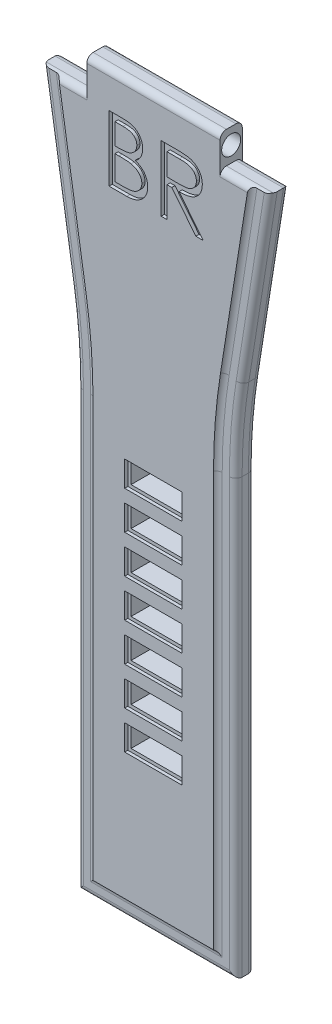
from build123d import *

# Parameters (mm, degrees)
SALIENTE_EXTRUIR1_DEPTH = 3.5
REDONDEO1_R             = 86
CORTAR_EXTRUIR1_DEPTH   = 0.5
REDONDEO2_R             = 1
REDONDEO3_R             = 1
CROQUIS3_R              = 1.5
CORTAR_EXTRUIR3_DEPTH   = 119.532810917
CROQUIS4_W              = 8
CROQUIS4_H              = 3
CORTAR_EXTRUIR4_DEPTH   = 119.532810917
MATRIZL1_COUNT          = 7
MATRIZL1_PITCH          = 6
CROQUIS5_W              = 9
CROQUIS5_H              = 4
CROQUIS5_W_2            = 8
CROQUIS5_H_2            = 3
CORTAR_EXTRUIR5_DEPTH   = 0.5
CORTAR_EXTRUIR6_DEPTH   = 0.5


with BuildPart() as part:
    # Croquis1 → Saliente-Extruir1 (new body)
    with BuildSketch(Plane.XY):
        Polygon((0, 0), (21, 0), (21, -5), (28.5, -5), (22.971798144, -39.903692839), (22.971798144, -115.002292401), (-2.025870662, -115.002292401), (-2.025870662, -39.562292401), (-7.5, -5), (0, -5), align=None)
    extrude(amount=SALIENTE_EXTRUIR1_DEPTH)

    # Redondeo1
    redondeo1_edges = [part.edges().sort_by_distance(p)[0] for p in [
        (22.971798144, -39.903692839, 1.75),
        (-2.025870662, -39.562292401, 1.75),
    ]]
    fillet(redondeo1_edges, radius=REDONDEO1_R)

    # Croquis2 → Cortar-Extruir1 (cut)
    with BuildSketch(Plane.XY.offset(3.5)):
        with BuildLine():
            Line((-4.462604623, -5), (-0.121608349, -32.407971799))
            ThreePointArc((-0.121608349, -32.407971799), (0.699772041, -39.347779668), (0.974129338, -46.330639188))
            Line((0.974129338, -46.330639188), (0.974129338, -112.002292401))
            Line((0.974129338, -112.002292401), (19.971798144, -112.002292401))
            Line((19.971798144, -112.002292401), (19.971798144, -46.672039626))
            ThreePointArc((19.971798144, -46.672039626), (20.246155442, -39.689180106), (21.067535831, -32.749372238))
            Line((21.067535831, -32.749372238), (25.462604623, -5))
            Line((25.462604623, -5), (28.5, -5))
            Line((28.5, -5), (24.030600853, -33.218675633))
            ThreePointArc((24.030600853, -33.218675633), (23.236907443, -39.924557394), (22.971798144, -46.672039626))
            Line((22.971798144, -46.672039626), (22.971798144, -115.002292401))
            Line((22.971798144, -115.002292401), (-2.025870662, -115.002292401))
            Line((-2.025870662, -115.002292401), (-2.025870662, -46.330639188))
            ThreePointArc((-2.025870662, -46.330639188), (-2.290979961, -39.583156955), (-3.084673371, -32.877275194))
            Line((-3.084673371, -32.877275194), (-7.5, -5))
            Line((-7.5, -5), (-4.462604623, -5))
        make_face()
    extrude(amount=-CORTAR_EXTRUIR1_DEPTH, mode=Mode.SUBTRACT)

    # Redondeo2
    # the kernel refuses this fillet: 1 mm, written as the material it adds along each edge
    with BuildSketch(Plane(origin=(21.067535831, -32.749372238, 3), x_dir=(0.9876883405951371, -0.1564344650402353, 0), z_dir=(0.15643446504023528, 0.9876883405951371, 0))) as redondeo2_piece_1_section:
        with BuildLine():
            CenterArc((0.866025404, -1), REDONDEO2_R, 90, 60)
            Line((0, -0.5), (-0.017320508, -0.49))
            ThreePointArc((-0.017320508, -0.49), (-0.02, -0.25), (-0.02, 0))
            Line((-0.02, 0), (0, 0.02))
            Line((0, 0.02), (0.866025404, 0.02))
            Line((0.866025404, 0.02), (0.866025404, 0))
        make_face()
    redondeo2_piece_1 = extrude(amount=30.260335163, mode=Mode.PRIVATE)
    redondeo2_piece_1 = split(redondeo2_piece_1, bisect_by=Plane(origin=(23.481611046, -5, 3.129439208), z_dir=(0, -1, 0)), keep=Keep.TOP, mode=Mode.PRIVATE)
    add(redondeo2_piece_1)
    with BuildSketch(Plane(origin=(108.971798144, -46.672039626, 3), x_dir=(-1, 0, 0), z_dir=(0, -1, 0))) as redondeo2_piece_2:
        with BuildLine():
            CenterArc((88.133974596, -1), REDONDEO2_R, 30, 60)
            Line((89, -0.5), (89.017320508, -0.49))
            ThreePointArc((89.017320508, -0.49), (89.02, -0.25), (89.02, 0))
            Line((89.02, 0), (89, 0.02))
            Line((89, 0.02), (88.133974596, 0.02))
            Line((88.133974596, 0.02), (88.133974596, 0))
        make_face()
    revolve(axis=Axis((108.971798144, -46.672039626, 3), (0, 0, -1)), revolution_arc=9)
    with BuildSketch(Plane(origin=(0.974129338, -46.330639188, 3), x_dir=(-1, 0, 0), z_dir=(0, -1, 0))) as redondeo2_piece_3:
        with BuildLine():
            CenterArc((0.866025404, -1), REDONDEO2_R, 90, 60)
            Line((0, -0.5), (-0.017320508, -0.49))
            ThreePointArc((-0.017320508, -0.49), (-0.02, -0.25), (-0.02, 0))
            Line((-0.02, 0), (0, 0.02))
            Line((0, 0.02), (0.866025404, 0.02))
            Line((0.866025404, 0.02), (0.866025404, 0))
        make_face()
    extrude(amount=65.671653213)
    with BuildSketch(Plane(origin=(-88.025870662, -46.330639188, 3), x_dir=(0.987688340595138, 0.1564344650402287, 0), z_dir=(-0.1564344650402287, 0.987688340595138, 0))) as redondeo2_piece_4:
        with BuildLine():
            CenterArc((88.133974596, -1), REDONDEO2_R, 30, 60)
            Line((89, -0.5), (89.017320508, -0.49))
            ThreePointArc((89.017320508, -0.49), (89.02, -0.25), (89.02, 0))
            Line((89.02, 0), (89, 0.02))
            Line((89, 0.02), (88.133974596, 0.02))
            Line((88.133974596, 0.02), (88.133974596, 0))
        make_face()
    revolve(axis=Axis((-88.025870662, -46.330639188, 3), (0, 0, -1)), revolution_arc=9)
    with BuildSketch(Plane(origin=(19.971798144, -112.002292401, 3), x_dir=(1, 0, 0), z_dir=(0, 1, 0))) as redondeo2_piece_5:
        with BuildLine():
            CenterArc((0.866025404, -1), REDONDEO2_R, 90, 60)
            Line((0, -0.5), (-0.017320508, -0.49))
            ThreePointArc((-0.017320508, -0.49), (-0.02, -0.25), (-0.02, 0))
            Line((-0.02, 0), (0, 0.02))
            Line((0, 0.02), (0.866025404, 0.02))
            Line((0.866025404, 0.02), (0.866025404, 0))
        make_face()
    extrude(amount=65.330252775)
    with BuildSketch(Plane(origin=(0.974129338, -112.002292401, 3), x_dir=(0, -1, 0), z_dir=(1, 0, 0))) as redondeo2_piece_6:
        with BuildLine():
            CenterArc((0.866025404, -1), REDONDEO2_R, 90, 60)
            Line((0, -0.5), (-0.017320508, -0.49))
            ThreePointArc((-0.017320508, -0.49), (-0.02, -0.25), (-0.02, 0))
            Line((-0.02, 0), (0, 0.02))
            Line((0, 0.02), (0.866025404, 0.02))
            Line((0.866025404, 0.02), (0.866025404, 0))
        make_face()
    extrude(amount=18.997668806)
    with BuildSketch(Plane(origin=(-4.801295175, -2.861592015, 3), x_dir=(-0.9876883405951382, -0.1564344650402279, 0), z_dir=(0.1564344650402279, -0.9876883405951382, 0))) as redondeo2_piece_7_section:
        with BuildLine():
            CenterArc((0.866025404, -1), REDONDEO2_R, 90, 60)
            Line((0, -0.5), (-0.017320508, -0.49))
            ThreePointArc((-0.017320508, -0.49), (-0.02, -0.25), (-0.02, 0))
            Line((-0.02, 0), (0, 0.02))
            Line((0, 0.02), (0.866025404, 0.02))
            Line((0.866025404, 0.02), (0.866025404, 0))
        make_face()
    redondeo2_piece_7 = extrude(amount=29.914679125, mode=Mode.PRIVATE)
    redondeo2_piece_7 = split(redondeo2_piece_7, bisect_by=Plane(origin=(-2.508649964, -5, 3.129438243), z_dir=(0, -1, 0)), keep=Keep.TOP, mode=Mode.PRIVATE)
    add(redondeo2_piece_7)
    with BuildSketch(Plane(origin=(0.974129338, -46.330639188, 3), x_dir=(-1, 0, 0), z_dir=(0, -1, 0))) as redondeo2_piece_8a_section:
        with BuildLine():
            CenterArc((0.866025404, -1), REDONDEO2_R, 90, 60)
            Line((0, -0.5), (-0.017320508, -0.49))
            ThreePointArc((-0.017320508, -0.49), (-0.02, -0.25), (-0.02, 0))
            Line((-0.02, 0), (0, 0.02))
            Line((0, 0.02), (0.866025404, 0.02))
            Line((0.866025404, 0.02), (0.866025404, 0))
        make_face()
    redondeo2_piece_8a = extrude(amount=67.836716723, mode=Mode.PRIVATE)
    redondeo2_piece_8a = split(redondeo2_piece_8a, bisect_by=Plane(origin=(0.757818892, -112.002292401, 3.129516711), z_dir=(0, -1, 0)), keep=Keep.TOP, mode=Mode.PRIVATE)
    with BuildSketch(Plane(origin=(-1.190934171, -112.002292401, 3), x_dir=(0, -1, 0), z_dir=(1, 0, 0))) as redondeo2_piece_8b_section:
        with BuildLine():
            CenterArc((0.866025404, -1), REDONDEO2_R, 90, 60)
            Line((0, -0.5), (-0.017320508, -0.49))
            ThreePointArc((-0.017320508, -0.49), (-0.02, -0.25), (-0.02, 0))
            Line((-0.02, 0), (0, 0.02))
            Line((0, 0.02), (0.866025404, 0.02))
            Line((0.866025404, 0.02), (0.866025404, 0))
        make_face()
    redondeo2_piece_8b = extrude(amount=21.162732316, mode=Mode.PRIVATE)
    redondeo2_piece_8b = split(redondeo2_piece_8b, bisect_by=Plane(origin=(0.974129338, -112.218602847, 3.129516711), z_dir=(-1, 0, 0)), keep=Keep.TOP, mode=Mode.PRIVATE)
    redondeo2_piece_8 = redondeo2_piece_8a & redondeo2_piece_8b
    add(redondeo2_piece_8)
    with BuildSketch(Plane(origin=(0.974129338, -112.002292401, 3), x_dir=(0, -1, 0), z_dir=(1, 0, 0))) as redondeo2_piece_9a_section:
        with BuildLine():
            CenterArc((0.866025404, -1), REDONDEO2_R, 90, 60)
            Line((0, -0.5), (-0.017320508, -0.49))
            ThreePointArc((-0.017320508, -0.49), (-0.02, -0.25), (-0.02, 0))
            Line((-0.02, 0), (0, 0.02))
            Line((0, 0.02), (0.866025404, 0.02))
            Line((0.866025404, 0.02), (0.866025404, 0))
        make_face()
    redondeo2_piece_9a = extrude(amount=21.162732316, mode=Mode.PRIVATE)
    redondeo2_piece_9a = split(redondeo2_piece_9a, bisect_by=Plane(origin=(19.971798144, -112.218602847, 3.129516711), z_dir=(1, 0, 0)), keep=Keep.TOP, mode=Mode.PRIVATE)
    with BuildSketch(Plane(origin=(19.971798144, -114.16735591, 3), x_dir=(1, 0, 0), z_dir=(0, 1, 0))) as redondeo2_piece_9b_section:
        with BuildLine():
            CenterArc((0.866025404, -1), REDONDEO2_R, 90, 60)
            Line((0, -0.5), (-0.017320508, -0.49))
            ThreePointArc((-0.017320508, -0.49), (-0.02, -0.25), (-0.02, 0))
            Line((-0.02, 0), (0, 0.02))
            Line((0, 0.02), (0.866025404, 0.02))
            Line((0.866025404, 0.02), (0.866025404, 0))
        make_face()
    redondeo2_piece_9b = extrude(amount=67.495316284, mode=Mode.PRIVATE)
    redondeo2_piece_9b = split(redondeo2_piece_9b, bisect_by=Plane(origin=(20.18810859, -112.002292401, 3.129516711), z_dir=(0, -1, 0)), keep=Keep.TOP, mode=Mode.PRIVATE)
    redondeo2_piece_9 = redondeo2_piece_9a & redondeo2_piece_9b
    add(redondeo2_piece_9)

    # Redondeo3
    # the kernel refuses this fillet: 1 mm, written as the material it takes off along each edge
    with BuildSketch(Plane(origin=(29.43860679, 0.926130044, 0), x_dir=(-0.9876883405951371, 0.1564344650402347, 0), z_dir=(-0.1564344650402347, -0.9876883405951372, 0))) as redondeo3_piece_1:
        with BuildLine():
            CenterArc((REDONDEO3_R, -REDONDEO3_R), REDONDEO3_R, 90, 90)
            Line((0, -REDONDEO3_R), (-REDONDEO3_R * 0.02, -REDONDEO3_R))
            Line((-REDONDEO3_R * 0.02, -REDONDEO3_R), (-REDONDEO3_R * 0.02, REDONDEO3_R * 0.02))
            Line((-REDONDEO3_R * 0.02, REDONDEO3_R * 0.02), (REDONDEO3_R, REDONDEO3_R * 0.02))
            Line((REDONDEO3_R, REDONDEO3_R * 0.02), (REDONDEO3_R, 0))
        make_face()
    extrude(amount=34.570424974, mode=Mode.SUBTRACT)
    with BuildSketch(Plane(origin=(108.971798144, -46.672039626, 0), x_dir=(-0.987688340595137, 0.15643446504023548, 0), z_dir=(0.15643446504023548, 0.987688340595137, 0))) as redondeo3_piece_2:
        with BuildLine():
            CenterArc((86 + REDONDEO3_R, REDONDEO3_R), REDONDEO3_R, 180, 90)
            Line((86, REDONDEO3_R), (86 - REDONDEO3_R * 0.02, REDONDEO3_R))
            Line((86 - REDONDEO3_R * 0.02, REDONDEO3_R), (86 - REDONDEO3_R * 0.02, -REDONDEO3_R * 0.02))
            Line((86 - REDONDEO3_R * 0.02, -REDONDEO3_R * 0.02), (86 + REDONDEO3_R, -REDONDEO3_R * 0.02))
            Line((86 + REDONDEO3_R, -REDONDEO3_R * 0.02), (86 + REDONDEO3_R, 0))
        make_face()
    revolve(axis=Axis((108.971798144, -46.672039626, 0), (0, 0, 1)), revolution_arc=9, mode=Mode.SUBTRACT)
    with BuildSketch(Plane(origin=(29.43860679, 0.926130044, 3), x_dir=(-0.9876883405951371, 0.15643446504023462, 0), z_dir=(-0.15643446504023462, -0.9876883405951372, 0))) as redondeo3_piece_3:
        with BuildLine():
            CenterArc((REDONDEO3_R, REDONDEO3_R), REDONDEO3_R, 180, 90)
            Line((0, REDONDEO3_R), (-REDONDEO3_R * 0.02, REDONDEO3_R))
            Line((-REDONDEO3_R * 0.02, REDONDEO3_R), (-REDONDEO3_R * 0.02, -REDONDEO3_R * 0.02))
            Line((-REDONDEO3_R * 0.02, -REDONDEO3_R * 0.02), (REDONDEO3_R, -REDONDEO3_R * 0.02))
            Line((REDONDEO3_R, -REDONDEO3_R * 0.02), (REDONDEO3_R, 0))
        make_face()
    extrude(amount=34.570424974, mode=Mode.SUBTRACT)
    with BuildSketch(Plane(origin=(108.971798144, -46.672039626, 3), x_dir=(-0.9876883405951384, 0.15643446504022676, 0), z_dir=(0.15643446504022676, 0.9876883405951384, 0))) as redondeo3_piece_4:
        with BuildLine():
            CenterArc((86 + REDONDEO3_R, -REDONDEO3_R), REDONDEO3_R, 90, 90)
            Line((86, -REDONDEO3_R), (86 - REDONDEO3_R * 0.02, -REDONDEO3_R))
            Line((86 - REDONDEO3_R * 0.02, -REDONDEO3_R), (86 - REDONDEO3_R * 0.02, REDONDEO3_R * 0.02))
            Line((86 - REDONDEO3_R * 0.02, REDONDEO3_R * 0.02), (86 + REDONDEO3_R, REDONDEO3_R * 0.02))
            Line((86 + REDONDEO3_R, REDONDEO3_R * 0.02), (86 + REDONDEO3_R, 0))
        make_face()
    revolve(axis=Axis((108.971798144, -46.672039626, 3), (0, 0, 1)), revolution_arc=9, mode=Mode.SUBTRACT)
    with BuildSketch(Plane(origin=(-3.084673371, -32.877275194, 0), x_dir=(0.9876883405951382, 0.15643446504022784, 0), z_dir=(-0.15643446504022784, 0.9876883405951382, 0))) as redondeo3_piece_5:
        with BuildLine():
            CenterArc((REDONDEO3_R, -REDONDEO3_R), REDONDEO3_R, 90, 90)
            Line((0, -REDONDEO3_R), (-REDONDEO3_R * 0.02, -REDONDEO3_R))
            Line((-REDONDEO3_R * 0.02, -REDONDEO3_R), (-REDONDEO3_R * 0.02, REDONDEO3_R * 0.02))
            Line((-REDONDEO3_R * 0.02, REDONDEO3_R * 0.02), (REDONDEO3_R, REDONDEO3_R * 0.02))
            Line((REDONDEO3_R, REDONDEO3_R * 0.02), (REDONDEO3_R, 0))
        make_face()
    extrude(amount=34.224768936, mode=Mode.SUBTRACT)
    with BuildSketch(Plane(origin=(-88.025870662, -46.330639188, 0), x_dir=(1, 0, 0), z_dir=(0, -1, 0))) as redondeo3_piece_6:
        with BuildLine():
            CenterArc((86 + REDONDEO3_R, REDONDEO3_R), REDONDEO3_R, 180, 90)
            Line((86, REDONDEO3_R), (86 - REDONDEO3_R * 0.02, REDONDEO3_R))
            Line((86 - REDONDEO3_R * 0.02, REDONDEO3_R), (86 - REDONDEO3_R * 0.02, -REDONDEO3_R * 0.02))
            Line((86 - REDONDEO3_R * 0.02, -REDONDEO3_R * 0.02), (86 + REDONDEO3_R, -REDONDEO3_R * 0.02))
            Line((86 + REDONDEO3_R, -REDONDEO3_R * 0.02), (86 + REDONDEO3_R, 0))
        make_face()
    revolve(axis=Axis((-88.025870662, -46.330639188, 0), (0, 0, 1)), revolution_arc=9, mode=Mode.SUBTRACT)
    with BuildSketch(Plane(origin=(-3.084673371, -32.877275194, 3), x_dir=(0.9876883405951382, 0.15643446504022784, 0), z_dir=(-0.15643446504022787, 0.9876883405951382, 0))) as redondeo3_piece_7:
        with BuildLine():
            CenterArc((REDONDEO3_R, REDONDEO3_R), REDONDEO3_R, 180, 90)
            Line((0, REDONDEO3_R), (-REDONDEO3_R * 0.02, REDONDEO3_R))
            Line((-REDONDEO3_R * 0.02, REDONDEO3_R), (-REDONDEO3_R * 0.02, -REDONDEO3_R * 0.02))
            Line((-REDONDEO3_R * 0.02, -REDONDEO3_R * 0.02), (REDONDEO3_R, -REDONDEO3_R * 0.02))
            Line((REDONDEO3_R, -REDONDEO3_R * 0.02), (REDONDEO3_R, 0))
        make_face()
    extrude(amount=34.224768936, mode=Mode.SUBTRACT)
    with BuildSketch(Plane(origin=(-88.025870662, -46.330639188, 3), x_dir=(1, 0, 0), z_dir=(0, -1, 0))) as redondeo3_piece_8:
        with BuildLine():
            CenterArc((86 + REDONDEO3_R, -REDONDEO3_R), REDONDEO3_R, 90, 90)
            Line((86, -REDONDEO3_R), (86 - REDONDEO3_R * 0.02, -REDONDEO3_R))
            Line((86 - REDONDEO3_R * 0.02, -REDONDEO3_R), (86 - REDONDEO3_R * 0.02, REDONDEO3_R * 0.02))
            Line((86 - REDONDEO3_R * 0.02, REDONDEO3_R * 0.02), (86 + REDONDEO3_R, REDONDEO3_R * 0.02))
            Line((86 + REDONDEO3_R, REDONDEO3_R * 0.02), (86 + REDONDEO3_R, 0))
        make_face()
    revolve(axis=Axis((-88.025870662, -46.330639188, 3), (0, 0, 1)), revolution_arc=9, mode=Mode.SUBTRACT)
    with BuildSketch(Plane(origin=(21, -5, 0), x_dir=(0, -1, 0), z_dir=(1, 0, 0))) as redondeo3_piece_9:
        with BuildLine():
            CenterArc((REDONDEO3_R, -REDONDEO3_R), REDONDEO3_R, 90, 90)
            Line((0, -REDONDEO3_R), (-REDONDEO3_R * 0.02, -REDONDEO3_R))
            Line((-REDONDEO3_R * 0.02, -REDONDEO3_R), (-REDONDEO3_R * 0.02, REDONDEO3_R * 0.02))
            Line((-REDONDEO3_R * 0.02, REDONDEO3_R * 0.02), (REDONDEO3_R, REDONDEO3_R * 0.02))
            Line((REDONDEO3_R, REDONDEO3_R * 0.02), (REDONDEO3_R, 0))
        make_face()
    extrude(amount=13.5, mode=Mode.SUBTRACT)
    with BuildSketch(Plane(origin=(21, -5, 3.5), x_dir=(0, 0, -1), z_dir=(1, 0, 0)), Plane(origin=(-10.462604623, -5, 3.5), x_dir=(0, 0, -1), z_dir=(1, 0, 0))) as redondeo3_piece_10:
        with BuildLine():
            CenterArc((REDONDEO3_R, -REDONDEO3_R), REDONDEO3_R, 90, 90)
            Line((0, -REDONDEO3_R), (-REDONDEO3_R * 0.02, -REDONDEO3_R))
            Line((-REDONDEO3_R * 0.02, -REDONDEO3_R), (-REDONDEO3_R * 0.02, REDONDEO3_R * 0.02))
            Line((-REDONDEO3_R * 0.02, REDONDEO3_R * 0.02), (REDONDEO3_R, REDONDEO3_R * 0.02))
            Line((REDONDEO3_R, REDONDEO3_R * 0.02), (REDONDEO3_R, 0))
        make_face()
    extrude(amount=10.462604623, mode=Mode.SUBTRACT)
    with BuildSketch(Plane(origin=(-6, 0, 0), x_dir=(0, 0, 1), z_dir=(1, 0, 0))) as redondeo3_piece_11:
        with BuildLine():
            CenterArc((REDONDEO3_R, REDONDEO3_R), REDONDEO3_R, 180, 90)
            Line((0, REDONDEO3_R), (-REDONDEO3_R * 0.02, REDONDEO3_R))
            Line((-REDONDEO3_R * 0.02, REDONDEO3_R), (-REDONDEO3_R * 0.02, -REDONDEO3_R * 0.02))
            Line((-REDONDEO3_R * 0.02, -REDONDEO3_R * 0.02), (REDONDEO3_R, -REDONDEO3_R * 0.02))
            Line((REDONDEO3_R, -REDONDEO3_R * 0.02), (REDONDEO3_R, 0))
        make_face()
    extrude(amount=33, mode=Mode.SUBTRACT)
    with BuildSketch(Plane(origin=(-6, 0, 3.5), x_dir=(0, 0, -1), z_dir=(1, 0, 0))) as redondeo3_piece_12:
        with BuildLine():
            CenterArc((REDONDEO3_R, -REDONDEO3_R), REDONDEO3_R, 90, 90)
            Line((0, -REDONDEO3_R), (-REDONDEO3_R * 0.02, -REDONDEO3_R))
            Line((-REDONDEO3_R * 0.02, -REDONDEO3_R), (-REDONDEO3_R * 0.02, REDONDEO3_R * 0.02))
            Line((-REDONDEO3_R * 0.02, REDONDEO3_R * 0.02), (REDONDEO3_R, REDONDEO3_R * 0.02))
            Line((REDONDEO3_R, REDONDEO3_R * 0.02), (REDONDEO3_R, 0))
        make_face()
    extrude(amount=33, mode=Mode.SUBTRACT)
    with BuildSketch(Plane(origin=(-13.5, -5, 0), x_dir=(0, 0, 1), z_dir=(1, 0, 0))) as redondeo3_piece_13:
        with BuildLine():
            CenterArc((REDONDEO3_R, REDONDEO3_R), REDONDEO3_R, 180, 90)
            Line((0, REDONDEO3_R), (-REDONDEO3_R * 0.02, REDONDEO3_R))
            Line((-REDONDEO3_R * 0.02, REDONDEO3_R), (-REDONDEO3_R * 0.02, -REDONDEO3_R * 0.02))
            Line((-REDONDEO3_R * 0.02, -REDONDEO3_R * 0.02), (REDONDEO3_R, -REDONDEO3_R * 0.02))
            Line((REDONDEO3_R, -REDONDEO3_R * 0.02), (REDONDEO3_R, 0))
        make_face()
    extrude(amount=13.5, mode=Mode.SUBTRACT)
    with BuildSketch(Plane(origin=(28.971798144, -115.002292401, 0), x_dir=(0, 1, 0), z_dir=(-1, 0, 0))) as redondeo3_piece_14:
        with BuildLine():
            CenterArc((REDONDEO3_R, -REDONDEO3_R), REDONDEO3_R, 90, 90)
            Line((0, -REDONDEO3_R), (-REDONDEO3_R * 0.02, -REDONDEO3_R))
            Line((-REDONDEO3_R * 0.02, -REDONDEO3_R), (-REDONDEO3_R * 0.02, REDONDEO3_R * 0.02))
            Line((-REDONDEO3_R * 0.02, REDONDEO3_R * 0.02), (REDONDEO3_R, REDONDEO3_R * 0.02))
            Line((REDONDEO3_R, REDONDEO3_R * 0.02), (REDONDEO3_R, 0))
        make_face()
    extrude(amount=36.997668806, mode=Mode.SUBTRACT)
    with BuildSketch(Plane(origin=(28.971798144, -115.002292401, 3), x_dir=(0, 1, 0), z_dir=(-1, 0, 0))) as redondeo3_piece_15:
        with BuildLine():
            CenterArc((REDONDEO3_R, REDONDEO3_R), REDONDEO3_R, 180, 90)
            Line((0, REDONDEO3_R), (-REDONDEO3_R * 0.02, REDONDEO3_R))
            Line((-REDONDEO3_R * 0.02, REDONDEO3_R), (-REDONDEO3_R * 0.02, -REDONDEO3_R * 0.02))
            Line((-REDONDEO3_R * 0.02, -REDONDEO3_R * 0.02), (REDONDEO3_R, -REDONDEO3_R * 0.02))
            Line((REDONDEO3_R, -REDONDEO3_R * 0.02), (REDONDEO3_R, 0))
        make_face()
    extrude(amount=36.997668806, mode=Mode.SUBTRACT)
    with BuildSketch(Plane(origin=(22.971798144, -46.672039626, 0), x_dir=(-1, 0, 0), z_dir=(0, -1, 0))) as redondeo3_piece_16:
        with BuildLine():
            CenterArc((REDONDEO3_R, -REDONDEO3_R), REDONDEO3_R, 90, 90)
            Line((0, -REDONDEO3_R), (-REDONDEO3_R * 0.02, -REDONDEO3_R))
            Line((-REDONDEO3_R * 0.02, -REDONDEO3_R), (-REDONDEO3_R * 0.02, REDONDEO3_R * 0.02))
            Line((-REDONDEO3_R * 0.02, REDONDEO3_R * 0.02), (REDONDEO3_R, REDONDEO3_R * 0.02))
            Line((REDONDEO3_R, REDONDEO3_R * 0.02), (REDONDEO3_R, 0))
        make_face()
    extrude(amount=74.330252775, mode=Mode.SUBTRACT)
    with BuildSketch(Plane(origin=(22.971798144, -46.672039626, 3), x_dir=(-1, 0, 0), z_dir=(0, -1, 0))) as redondeo3_piece_17:
        with BuildLine():
            CenterArc((REDONDEO3_R, REDONDEO3_R), REDONDEO3_R, 180, 90)
            Line((0, REDONDEO3_R), (-REDONDEO3_R * 0.02, REDONDEO3_R))
            Line((-REDONDEO3_R * 0.02, REDONDEO3_R), (-REDONDEO3_R * 0.02, -REDONDEO3_R * 0.02))
            Line((-REDONDEO3_R * 0.02, -REDONDEO3_R * 0.02), (REDONDEO3_R, -REDONDEO3_R * 0.02))
            Line((REDONDEO3_R, -REDONDEO3_R * 0.02), (REDONDEO3_R, 0))
        make_face()
    extrude(amount=74.330252775, mode=Mode.SUBTRACT)
    with BuildSketch(Plane(origin=(-2.025870662, -121.002292401, 0), x_dir=(1, 0, 0), z_dir=(0, 1, 0))) as redondeo3_piece_18:
        with BuildLine():
            CenterArc((REDONDEO3_R, -REDONDEO3_R), REDONDEO3_R, 90, 90)
            Line((0, -REDONDEO3_R), (-REDONDEO3_R * 0.02, -REDONDEO3_R))
            Line((-REDONDEO3_R * 0.02, -REDONDEO3_R), (-REDONDEO3_R * 0.02, REDONDEO3_R * 0.02))
            Line((-REDONDEO3_R * 0.02, REDONDEO3_R * 0.02), (REDONDEO3_R, REDONDEO3_R * 0.02))
            Line((REDONDEO3_R, REDONDEO3_R * 0.02), (REDONDEO3_R, 0))
        make_face()
    extrude(amount=74.671653213, mode=Mode.SUBTRACT)
    with BuildSketch(Plane(origin=(-2.025870662, -121.002292401, 3), x_dir=(1, 0, 0), z_dir=(0, 1, 0))) as redondeo3_piece_19:
        with BuildLine():
            CenterArc((REDONDEO3_R, REDONDEO3_R), REDONDEO3_R, 180, 90)
            Line((0, REDONDEO3_R), (-REDONDEO3_R * 0.02, REDONDEO3_R))
            Line((-REDONDEO3_R * 0.02, REDONDEO3_R), (-REDONDEO3_R * 0.02, -REDONDEO3_R * 0.02))
            Line((-REDONDEO3_R * 0.02, -REDONDEO3_R * 0.02), (REDONDEO3_R, -REDONDEO3_R * 0.02))
            Line((REDONDEO3_R, -REDONDEO3_R * 0.02), (REDONDEO3_R, 0))
        make_face()
    extrude(amount=74.671653213, mode=Mode.SUBTRACT)

    # Croquis3 → Cortar-Extruir3 (cut, through all)
    with BuildSketch(Plane(origin=(21, 0, 0), x_dir=(0, 0, -1), z_dir=(1, 0, 0))):
        with Locations((-1.75, -2.5)):
            Circle(CROQUIS3_R)
    extrude(amount=-CORTAR_EXTRUIR3_DEPTH, mode=Mode.SUBTRACT)

    # Croquis4 → Cortar-Extruir4 (cut, through all)
    with BuildSketch(Plane.XY.offset(3.5)):
        with Locations((10.472963741, -90.002292401)):
            Rectangle(CROQUIS4_W, CROQUIS4_H)
    cortar_extruir4 = extrude(amount=-CORTAR_EXTRUIR4_DEPTH, mode=Mode.SUBTRACT)

    # MatrizL1: Cortar-Extruir4 ×7
    with Locations(*[(0, i * MATRIZL1_PITCH, 0) for i in range(1, MATRIZL1_COUNT)]):
        add(cortar_extruir4, mode=Mode.SUBTRACT)

    # Croquis5 → Cortar-Extruir5 (cut)
    # profile 1 of 7: a face of its own
    with BuildSketch(Plane.XY.offset(3.5)):
        with Locations((10.472963741, -54.002292401)):
            Rectangle(CROQUIS5_W, CROQUIS5_H)
        with Locations((10.472963741, -54.002292401)):
            Rectangle(CROQUIS5_W_2, CROQUIS5_H_2, mode=Mode.SUBTRACT)
    # profile 2 of 7: a face of its own
    with BuildSketch(Plane.XY.offset(3.5)):
        with Locations((10.472963741, -60.002292401)):
            Rectangle(CROQUIS5_W, CROQUIS5_H)
        with Locations((10.472963741, -60.002292401)):
            Rectangle(CROQUIS5_W_2, CROQUIS5_H_2, mode=Mode.SUBTRACT)
    # profile 3 of 7: a face of its own
    with BuildSketch(Plane.XY.offset(3.5)):
        with Locations((10.472963741, -66.002292401)):
            Rectangle(CROQUIS5_W, CROQUIS5_H)
        with Locations((10.472963741, -66.002292401)):
            Rectangle(CROQUIS5_W_2, CROQUIS5_H_2, mode=Mode.SUBTRACT)
    # profile 4 of 7: a face of its own
    with BuildSketch(Plane.XY.offset(3.5)):
        with Locations((10.472963741, -72.002292401)):
            Rectangle(CROQUIS5_W, CROQUIS5_H)
        with Locations((10.472963741, -72.002292401)):
            Rectangle(CROQUIS5_W_2, CROQUIS5_H_2, mode=Mode.SUBTRACT)
    # profile 5 of 7: a face of its own
    with BuildSketch(Plane.XY.offset(3.5)):
        with Locations((10.472963741, -78.002292401)):
            Rectangle(CROQUIS5_W, CROQUIS5_H)
        with Locations((10.472963741, -78.002292401)):
            Rectangle(CROQUIS5_W_2, CROQUIS5_H_2, mode=Mode.SUBTRACT)
    # profile 6 of 7: a face of its own
    with BuildSketch(Plane.XY.offset(3.5)):
        with Locations((10.472963741, -84.002292401)):
            Rectangle(CROQUIS5_W, CROQUIS5_H)
        with Locations((10.472963741, -84.002292401)):
            Rectangle(CROQUIS5_W_2, CROQUIS5_H_2, mode=Mode.SUBTRACT)
    # profile 7 of 7: a face of its own
    with BuildSketch(Plane.XY.offset(3.5)):
        with Locations((10.472963741, -90.002292401)):
            Rectangle(CROQUIS5_W, CROQUIS5_H)
        with Locations((10.472963741, -90.002292401)):
            Rectangle(CROQUIS5_W_2, CROQUIS5_H_2, mode=Mode.SUBTRACT)
    extrude(amount=-CORTAR_EXTRUIR5_DEPTH, mode=Mode.SUBTRACT)

    # Croquis6 → Cortar-Extruir6 (cut)
    # profile 1 of 2: a face of its own
    with BuildSketch(Plane.XY.offset(3.5)):
        with BuildLine():
            Line((3.515965496, -5.68125), (5.529279298, -5.68125))
            add(Edge.make_bspline(
                [(5.529279298, -5.68125), (5.627833615, -5.68176815), (5.81885641, -5.682772453), (6.096635514, -5.698348256), (6.356811918, -5.719586218), (6.599461076, -5.753284581), (6.824470861, -5.793945695), (7.032519377, -5.843186228), (7.222945046, -5.902228976), (7.450289917, -5.996118638), (7.709498865, -6.135637479), (7.990164126, -6.341801873), (8.230161268, -6.593969903), (8.437085571, -6.878421446), (8.601599229, -7.191332445), (8.720616568, -7.525244803), (8.795966661, -7.875851581), (8.803715849, -8.116553165), (8.807632163, -8.23819987)],
                knots=[0, 0, 0, 0, 1.001505555, 1.941167018, 2.826882275, 3.653841531, 4.429895133, 5.150066043, 5.825578002, 6.45369114, 7.647487171, 8.808567382, 9.977351308, 11.170798116, 12.373658725, 13.556498008, 14.765093433, 16, 16, 16, 16], degree=3))
            add(Edge.make_bspline(
                [(8.807632163, -8.23819987), (8.804409121, -8.352155887), (8.798075539, -8.576090206), (8.737511082, -8.903619446), (8.64269454, -9.2153967), (8.510893886, -9.510284126), (8.339596751, -9.781618939), (8.136587672, -10.031589968), (7.891659456, -10.249613531), (7.708153047, -10.371501267), (7.614940106, -10.433414714)],
                knots=[0, 0, 0, 0, 1.044552857, 2.05264487, 3.044412934, 4.028983338, 5.005914585, 5.980388656, 6.974128949, 8, 8, 8, 8], degree=3))
            add(Edge.make_bspline(
                [(7.614940106, -10.433414714), (7.732162366, -10.478419201), (7.956437589, -10.564523935), (8.265074386, -10.716756348), (8.530988117, -10.882334284), (8.756223274, -11.063153721), (8.948852682, -11.258056661), (9.117056979, -11.469900936), (9.260580102, -11.701450024), (9.383558739, -11.950289732), (9.479519447, -12.21387916), (9.551384836, -12.489745858), (9.592563869, -12.776900618), (9.598423862, -12.972324121), (9.601382163, -13.070979818)],
                knots=[0, 0, 0, 0, 1.27268992, 2.434971085, 3.483601985, 4.442670788, 5.356604649, 6.2567628, 7.179492994, 8.113709626, 9.066344395, 10.018646069, 10.999752585, 12, 12, 12, 12], degree=3))
            add(Edge.make_bspline(
                [(9.601382163, -13.070979818), (9.598502212, -13.171711078), (9.592835827, -13.369902655), (9.551030231, -13.661053954), (9.480246239, -13.93929152), (9.382745413, -14.206415014), (9.25549366, -14.46190766), (9.100629965, -14.706058908), (8.915978695, -14.936415658), (8.709418344, -15.155537625), (8.475736554, -15.352560262), (8.223617784, -15.528025319), (7.949886937, -15.672328799), (7.659039719, -15.793547641), (7.347813494, -15.886142792), (7.017605807, -15.950922648), (6.668701446, -15.99457107), (6.429277697, -15.99815965), (6.30649284, -16)],
                knots=[0, 0, 0, 0, 0.978564426, 1.925352924, 2.850884081, 3.763762016, 4.682927383, 5.618979971, 6.567305752, 7.547517671, 8.540179244, 9.531824382, 10.526200242, 11.540722885, 12.589160233, 13.674978461, 14.80764778, 16, 16, 16, 16], degree=3))
            Line((6.30649284, -16), (3.515965496, -16))
            Line((3.515965496, -16), (3.515965496, -5.68125))
        make_face()
        with BuildLine():
            Line((4.442007163, -6.739583333), (4.442007163, -10.046875))
            Line((4.442007163, -10.046875), (5.064191408, -10.046875))
            add(Edge.make_bspline(
                [(5.064191408, -10.046875), (5.155140267, -10.045695941), (5.330871997, -10.04341776), (5.585361549, -10.036891837), (5.821587273, -10.018618677), (6.039141409, -10.000350768), (6.237681365, -9.970648725), (6.416767285, -9.935293377), (6.579209755, -9.897901455), (6.766537951, -9.834309986), (6.979024447, -9.740327768), (7.205544903, -9.594474194), (7.405240634, -9.420752574), (7.5738702, -9.22030065), (7.711880446, -8.999579091), (7.807737845, -8.762109627), (7.872737963, -8.513810631), (7.878609425, -8.343350032), (7.881590496, -8.256803385)],
                knots=[0, 0, 0, 0, 1.156816544, 2.235205308, 3.236616184, 4.169592532, 5.011045266, 5.787822928, 6.49130361, 7.128639758, 8.301311294, 9.436451833, 10.541879658, 11.654887649, 12.756523258, 13.837046038, 14.901820046, 16, 16, 16, 16], degree=3))
            add(Edge.make_bspline(
                [(7.881590496, -8.256803385), (7.880039204, -8.199532048), (7.876996176, -8.087188067), (7.852074028, -7.923416667), (7.80971534, -7.76939089), (7.755308129, -7.622999932), (7.679277549, -7.488821245), (7.589759553, -7.362215502), (7.481602276, -7.247494239), (7.358492771, -7.140269164), (7.216953063, -7.045205387), (7.057067594, -6.961945565), (6.87667321, -6.894900883), (6.678810132, -6.836183797), (6.460432694, -6.79494331), (6.22406093, -6.760586626), (5.96775875, -6.743095631), (5.790438099, -6.740780213), (5.698777996, -6.739583333)],
                knots=[0, 0, 0, 0, 0.91205012, 1.789085906, 2.630437955, 3.453916878, 4.269457761, 5.079663411, 5.91843418, 6.774407191, 7.675494373, 8.627863946, 9.638891023, 10.736472738, 11.911756761, 13.175263542, 14.539845004, 16, 16, 16, 16], degree=3))
            Line((5.698777996, -6.739583333), (4.442007163, -6.739583333))
        make_face(mode=Mode.SUBTRACT)
        with BuildLine():
            Line((4.442007163, -11.105208333), (4.442007163, -14.941666667))
            Line((4.442007163, -14.941666667), (5.760789715, -14.941666667))
            add(Edge.make_bspline(
                [(5.760789715, -14.941666667), (5.85518837, -14.940535297), (6.037129332, -14.938354731), (6.299818852, -14.931236107), (6.543291538, -14.915043702), (6.766436381, -14.889553884), (6.971662912, -14.861904206), (7.156509176, -14.824723448), (7.322473573, -14.782124816), (7.51491622, -14.71627889), (7.731620313, -14.613986259), (7.965150891, -14.459752709), (8.172782474, -14.276010243), (8.349101193, -14.063352851), (8.493601986, -13.832120493), (8.598721908, -13.586990184), (8.663555666, -13.332012317), (8.671404312, -13.158165813), (8.675340496, -13.070979818)],
                knots=[0, 0, 0, 0, 1.160039823, 2.235823828, 3.228722157, 4.157150951, 4.99529583, 5.772374946, 6.472645482, 7.099169577, 8.269452708, 9.405989375, 10.527446681, 11.663510218, 12.788923519, 13.866172445, 14.929861265, 16, 16, 16, 16], degree=3))
            add(Edge.make_bspline(
                [(8.675340496, -13.070979818), (8.674526482, -13.016457487), (8.672911582, -12.908292276), (8.648557519, -12.749336887), (8.613138057, -12.595363822), (8.567348062, -12.445954983), (8.500661026, -12.303811618), (8.422808872, -12.166122465), (8.331528026, -12.03270551), (8.189293887, -11.864031528), (7.982411839, -11.669694048), (7.6884549, -11.479423662), (7.354209071, -11.325975574), (7.111784802, -11.260821582), (6.986554689, -11.227164714)],
                knots=[0, 0, 0, 0, 0.723448775, 1.435228256, 2.130040452, 2.821711965, 3.505591119, 4.210454504, 4.921174351, 5.648778258, 7.137944449, 8.670945889, 10.280296675, 12, 12, 12, 12], degree=3))
            add(Edge.make_bspline(
                [(6.986554689, -11.227164714), (6.936349265, -11.216978386), (6.827493551, -11.194892326), (6.649988702, -11.171578722), (6.447340632, -11.150808375), (6.219081399, -11.135444766), (5.96492221, -11.119564081), (5.684320259, -11.1133881), (5.378421462, -11.106019745), (5.166172521, -11.105485723), (5.055923179, -11.105208333)],
                knots=[0, 0, 0, 0, 0.634451884, 1.375622551, 2.216452059, 3.157844607, 4.20941857, 5.370758133, 6.634282058, 8, 8, 8, 8], degree=3))
            Line((5.055923179, -11.105208333), (4.442007163, -11.105208333))
        make_face(mode=Mode.SUBTRACT)
    # profile 2 of 2: a face of its own
    with BuildSketch(Plane.XY.offset(3.5)):
        with BuildLine():
            Line((11.71804883, -5.68125), (13.783039064, -5.68125))
            add(Edge.make_bspline(
                [(13.783039064, -5.68125), (13.920841927, -5.681708701), (14.185438688, -5.682589457), (14.564500241, -5.687500483), (14.908931557, -5.701576307), (15.218552548, -5.713689291), (15.493357532, -5.73577714), (15.73418917, -5.756888262), (15.939938257, -5.784523823), (16.064488079, -5.810189275), (16.120880861, -5.821809896)],
                knots=[0, 0, 0, 0, 1.410062039, 2.707475311, 3.878576406, 4.937260626, 5.877586885, 6.699081471, 7.410979367, 8, 8, 8, 8], degree=3))
            add(Edge.make_bspline(
                [(16.120880861, -5.821809896), (16.196374676, -5.840462556), (16.345751818, -5.877369964), (16.560824245, -5.955378537), (16.765767368, -6.045651752), (16.959729868, -6.151680506), (17.141740209, -6.274251865), (17.313675086, -6.411249848), (17.476314694, -6.561924842), (17.623081607, -6.730075776), (17.76146799, -6.906486629), (17.878183744, -7.097247169), (17.978795919, -7.296727851), (18.058900425, -7.506957399), (18.123401379, -7.725897016), (18.168881239, -7.955529879), (18.196155722, -8.194809825), (18.198932514, -8.358016803), (18.200340496, -8.440771484)],
                knots=[0, 0, 0, 0, 1.027469482, 2.033020251, 3.019912614, 3.986113645, 4.951240523, 5.91722682, 6.890402269, 7.87763091, 8.8651537, 9.85103654, 10.82876324, 11.815024772, 12.821070561, 13.842952187, 14.906261191, 16, 16, 16, 16], degree=3))
            add(Edge.make_bspline(
                [(18.200340496, -8.440771484), (18.196009575, -8.578261766), (18.187558826, -8.846540916), (18.108767494, -9.235884693), (17.979704933, -9.599073191), (17.80185895, -9.935649111), (17.575378675, -10.239051746), (17.303185407, -10.505542177), (16.985127299, -10.728544848), (16.689040155, -10.883186956), (16.427491684, -10.982226049), (16.212173828, -11.0519111), (15.977298506, -11.105751287), (15.725116115, -11.153984461), (15.454577195, -11.190399903), (15.166330168, -11.217071202), (14.86016946, -11.233740549), (14.649846597, -11.23622296), (14.54164909, -11.2375)],
                knots=[0, 0, 0, 0, 1.260483769, 2.459530307, 3.627416485, 4.787058657, 5.939039949, 7.08810263, 8.267026773, 9.491475466, 10.141966685, 10.831826277, 11.566392101, 12.351337768, 13.187381173, 14.07005841, 15.007169909, 16, 16, 16, 16], degree=3))
            Line((14.54164909, -11.2375), (18.332632163, -16))
            Line((18.332632163, -16), (17.187482423, -16))
            Line((17.187482423, -16), (13.396499351, -11.2375))
            Line((13.396499351, -11.2375), (12.644090496, -11.2375))
            Line((12.644090496, -11.2375), (12.644090496, -16))
            Line((12.644090496, -16), (11.71804883, -16))
            Line((11.71804883, -16), (11.71804883, -5.68125))
        make_face()
        with BuildLine():
            Line((12.644090496, -6.739583333), (12.644090496, -10.179166667))
            Line((12.644090496, -10.179166667), (14.533380861, -10.193636068))
            add(Edge.make_bspline(
                [(14.533380861, -10.193636068), (14.621591547, -10.193675092), (14.792568981, -10.193750733), (15.039926119, -10.181976225), (15.270240949, -10.168581549), (15.482632523, -10.148093389), (15.677195725, -10.12168897), (15.853833306, -10.088660172), (16.012833603, -10.050179895), (16.198271973, -9.990621173), (16.405344318, -9.896260573), (16.630385818, -9.758975504), (16.822026639, -9.58630119), (16.983936265, -9.388849091), (17.114039286, -9.17175365), (17.205764289, -8.937617175), (17.263969239, -8.692350518), (17.27083429, -8.523777203), (17.27429883, -8.438704427)],
                knots=[0, 0, 0, 0, 1.146690395, 2.22261258, 3.21895312, 4.145990853, 4.996080663, 5.770904154, 6.481378293, 7.121626537, 8.300444488, 9.431385265, 10.535395872, 11.636531494, 12.74115979, 13.810798291, 14.895190096, 16, 16, 16, 16], degree=3))
            add(Edge.make_bspline(
                [(17.27429883, -8.438704427), (17.270754719, -8.355722296), (17.263731585, -8.191281993), (17.206392448, -7.950542871), (17.109427504, -7.723332988), (16.978756049, -7.510576623), (16.819554969, -7.317451676), (16.632880489, -7.152212659), (16.42383678, -7.015859326), (16.228455086, -6.92872668), (16.053819935, -6.875305469), (15.902194276, -6.837712306), (15.730869187, -6.807509417), (15.539012791, -6.783310294), (15.327444126, -6.762510807), (15.095093438, -6.748501545), (14.843502324, -6.740205671), (14.669124496, -6.739795607), (14.578856121, -6.739583333)],
                knots=[0, 0, 0, 0, 1.101028733, 2.181837193, 3.264309656, 4.369019818, 5.486613113, 6.575447106, 7.666700264, 8.788928104, 9.402425223, 10.0903467, 10.862060571, 11.710948788, 12.657782767, 13.684531032, 14.801375019, 16, 16, 16, 16], degree=3))
            Line((14.578856121, -6.739583333), (12.644090496, -6.739583333))
        make_face(mode=Mode.SUBTRACT)
    extrude(amount=-CORTAR_EXTRUIR6_DEPTH, mode=Mode.SUBTRACT)


solid = part.part
